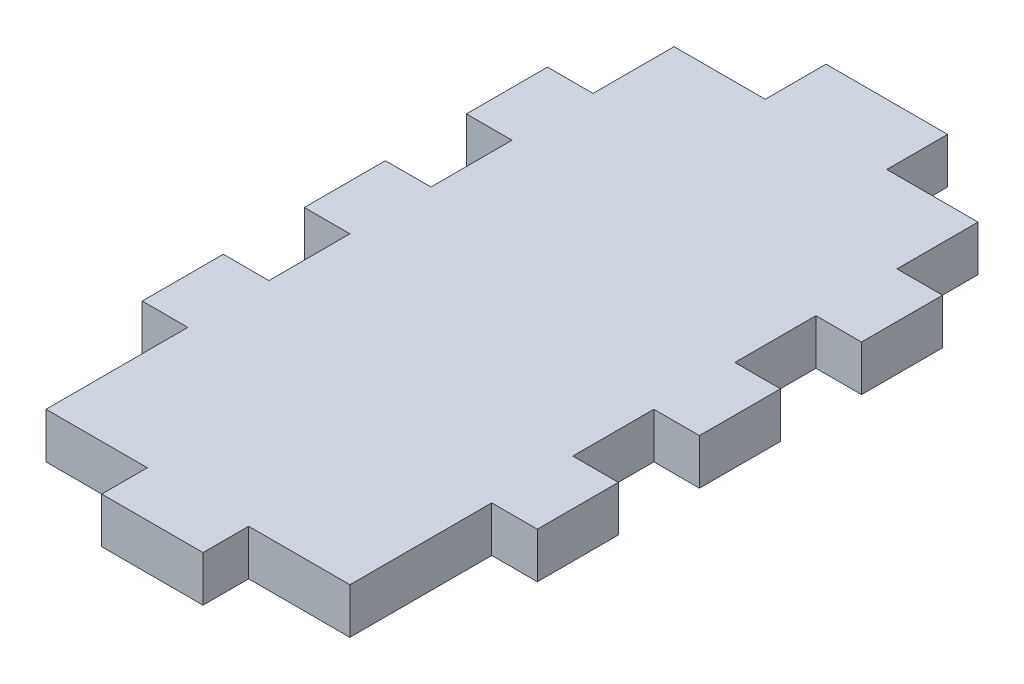
from build123d import *

# Parameters (mm, degrees)
BOSS_EXTRUDE2_DEPTH = 4.5


with BuildPart() as part:
    # Sketch1 → Boss-Extrude2 (new body)
    with BuildSketch(Plane(origin=(0, 0, 0), x_dir=(1, 0, 0), z_dir=(0, 1, 0))):
        Polygon((-15, 30), (-15, 22), (-19.5, 22), (-19.5, 14), (-15, 14), (-15, 6), (-19.5, 6), (-19.5, -2), (-15, -2), (-15, -10), (-19.5, -10), (-19.5, -18), (-15, -18), (-15, -32), (-5, -32), (-5, -36.5), (5, -36.5), (5, -32), (15, -32), (15, -18), (19.5, -18), (19.5, -10), (15, -10), (15, -2), (19.5, -2), (19.5, 6), (15, 6), (15, 14), (19.5, 14), (19.5, 22), (15, 22), (15, 30), (6, 30), (6, 36), (-6, 36), (-6, 30), align=None)
    extrude(amount=BOSS_EXTRUDE2_DEPTH)


solid = part.part
